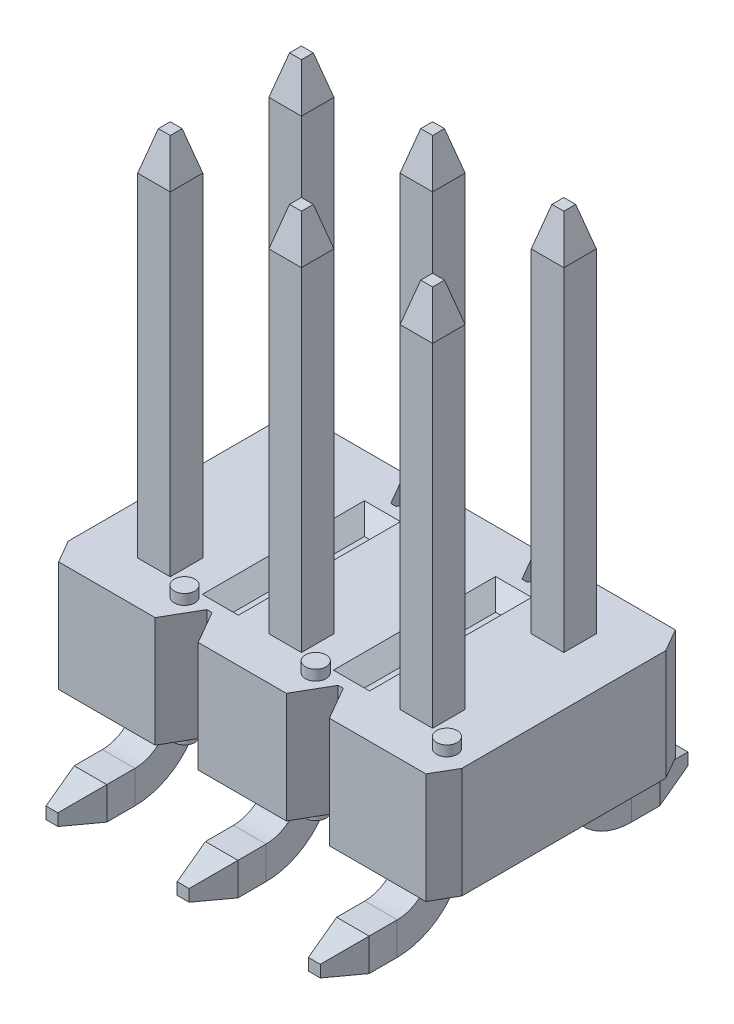
from build123d import *

# Parameters (mm, degrees)
BOSS_EXTRUDE1_DEPTH      = 2.14
BOSS_EXTRUDE2_START      = -2.34
SKETCH2_R                = 0.2
BOSS_EXTRUDE2_DEPTH      = 2.54
LPATTERN1_COUNT          = 3
LPATTERN1_PITCH          = 2.54
SKETCH3_W                = 0.1
SKETCH3_H                = 2.54
CUT_EXTRUDE1_DEPTH       = 0.3
CHAMFER1_SIZE            = 0.3
CHAMFER1_OF_MIRROR2_SIZE = 0.3
SKETCH6_W                = 0.63
SKETCH6_H                = 0.63
CHAMFER2_SIZE            = 0.2
CHAMFER2_SIZE2           = 0.746410162
CHAMFER3_SIZE            = 0.2
CHAMFER3_SIZE2           = 0.746410162
LPATTERN2_START          = -0.315
LPATTERN2_DEPTH          = 0.63
LPATTERN2_START_2        = 2.225
LPATTERN2_2_DEPTH        = 0.63
LPATTERN2_START_3        = -1
LPATTERN2_3_DEPTH        = 2.36
LPATTERN2_START_4        = -3
LPATTERN2_4_DEPTH        = 3
MIRROR4_START            = -2.855
MIRROR4_DEPTH            = 0.63
MIRROR4_START_2          = -0.315
MIRROR4_2_DEPTH          = 0.63
MIRROR4_START_3          = 2.225
MIRROR4_3_DEPTH          = 0.63
MIRROR4_4_DEPTH          = 2.813589838
MIRROR4_START_4          = -1
MIRROR4_5_DEPTH          = 2.36


with BuildPart() as part:
    # Sketch1 → Boss-Extrude1 (new body)
    with BuildSketch(Plane(origin=(0, 1.36, 0), x_dir=(1, 0, 0), z_dir=(0, 1, 0))):
        Polygon((-1.686617421, 2.415), (-1.32, 1.78), (-1.22, 1.78), (-0.853382579, 2.415), (0.853382579, 2.415), (1.22, 1.78), (1.32, 1.78), (1.686617421, 2.415), (3.556, 2.415), (3.81, 1.975059095), (3.81, -1.975059095), (3.556, -2.415), (1.686617421, -2.415), (1.32, -1.78), (1.22, -1.78), (0.853382579, -2.415), (-0.853382579, -2.415), (-1.22, -1.78), (-1.32, -1.78), (-1.686617421, -2.415), (-3.556, -2.415), (-3.81, -1.975059095), (-3.81, 1.975059095), (-3.556, 2.415), align=None)
    extrude(amount=BOSS_EXTRUDE1_DEPTH)

    # Sketch2 → Boss-Extrude2 (add)
    with BuildSketch(Plane(origin=(0, 3.5, 0), x_dir=(1, 0, 0), z_dir=(0, 1, 0)).offset(BOSS_EXTRUDE2_START)):
        with Locations(Location((-3.3325, 1.785, 0), (0, 0, 270))):
            Circle(SKETCH2_R)
        with Locations(Location((-1.7475, -1.785, 0), (0, 0, 270))):
            Circle(SKETCH2_R)
    boss_extrude2 = extrude(amount=BOSS_EXTRUDE2_DEPTH)

    # LPattern1: Boss-Extrude2 ×3
    with Locations(*[(i * LPATTERN1_PITCH, 0, 0) for i in range(1, LPATTERN1_COUNT)]):
        add(boss_extrude2)

    # Sketch3 → Cut-Extrude1 (cut)
    with BuildSketch(Plane(origin=(0, 3.5, 0), x_dir=(1, 0, 0), z_dir=(0, 1, 0))):
        with Locations((-1.27, 0)):
            Rectangle(SKETCH3_W, SKETCH3_H)
        with Locations((1.27, 0)):
            Rectangle(SKETCH3_W, SKETCH3_H)
    cut_extrude1 = extrude(amount=-CUT_EXTRUDE1_DEPTH, mode=Mode.SUBTRACT)

    # Chamfer1
    chamfer1_edges = [part.edges().sort_by_distance(p)[0] for p in [
        (-1.27, 3.5, 1.27),
        (-1.22, 3.5, 0),
        (-1.27, 3.5, -1.27),
        (-1.32, 3.5, 0),
        (1.27, 3.5, 1.27),
        (1.32, 3.5, 0),
        (1.22, 3.5, 0),
        (1.27, 3.5, -1.27),
    ]]
    chamfer(chamfer1_edges, length=CHAMFER1_SIZE - 0.0001)  # a hair under: the kernel refuses the full size

    # Mirror2: Cut-Extrude1 across plane
    add(cut_extrude1.mirror(Plane.ZX.offset(2.43)), mode=Mode.SUBTRACT)

    # Chamfer1 of Mirror2
    chamfer1_of_mirror2_edges = [part.edges().sort_by_distance(p)[0] for p in [
        (-1.27, 1.36, 1.27),
        (-1.22, 1.36, 0),
        (-1.27, 1.36, -1.27),
        (-1.32, 1.36, 0),
        (1.27, 1.36, 1.27),
        (1.32, 1.36, 0),
        (1.22, 1.36, 0),
        (1.27, 1.36, -1.27),
    ]]
    chamfer(chamfer1_of_mirror2_edges, length=CHAMFER1_OF_MIRROR2_SIZE - 0.0001)  # a hair under: the kernel refuses the full size

    # Sweep1: sweep along a path in Sketch5
    with BuildLine(Plane(origin=(-2.54, 0, 0), x_dir=(0, 0, -1), z_dir=(1, 0, 0))) as sweep1_path:
        Line((1.27, 10.7), (1.27, 1.315))
        ThreePointArc((1.27, 1.315), (1.562893219, 0.607893219), (2.27, 0.315))
        Line((2.27, 0.315), (3.56, 0.315))
    # Sketch6 → Sweep1 (sweep)
    with BuildSketch(Plane(origin=(0, 10.7, 0), x_dir=(1, 0, 0), z_dir=(0, 1, 0))):
        with Locations((-2.54, 1.27)):
            Rectangle(SKETCH6_W, SKETCH6_H)
    sweep(path=sweep1_path.line)

    # Chamfer2
    chamfer2_edges = [part.edges().sort_by_distance(p)[0] for p in [
        (-2.54, 0, -3.56),
        (-2.855, 0.315, -3.56),
        (-2.54, 0.63, -3.56),
        (-2.225, 0.315, -3.56),
    ]]
    chamfer2_side = [part.faces().sort_by_distance(p)[0] for p in [
        (-2.54, 0.315, -3.56),
    ]]
    chamfer(chamfer2_edges, length=CHAMFER2_SIZE, length2=CHAMFER2_SIZE2, reference=chamfer2_side[0])

    # Chamfer3
    chamfer3_edges = [part.edges().sort_by_distance(p)[0] for p in [
        (-2.225, 10.7, -1.27),
        (-2.54, 10.7, -1.585),
        (-2.855, 10.7, -1.27),
        (-2.54, 10.7, -0.955),
    ]]
    chamfer3_side = [part.faces().sort_by_distance(p)[0] for p in [
        (-2.54, 10.7, -1.27),
    ]]
    chamfer(chamfer3_edges, length=CHAMFER3_SIZE, length2=CHAMFER3_SIZE2, reference=chamfer3_side[0])

    # LPattern2: read off the stored shape, not the designer's step
    # LPattern2 outline → LPattern2 (add)
    with BuildSketch(Plane.YZ.offset(LPATTERN2_START)):
        Polygon((10.7, -1.385), (10.7, -1.155), (9.953589838, -0.955), (3.5, -0.955), (3.5, -1.585), (9.953589838, -1.585), align=None)
        with BuildLine():
            ThreePointArc((0.63, -2.27), (0.830631855, -1.785631855), (1.315, -1.585))
            Line((1.315, -1.585), (1.36, -1.585))
            Line((1.36, -1.585), (1.36, -0.955))
            Line((1.36, -0.955), (1.315, -0.955))
            ThreePointArc((1.315, -0.955), (0.385154583, -1.340154583), (0, -2.27))
            Line((0, -2.27), (0, -2.813589838))
            Line((0, -2.813589838), (0.2, -3.56))
            Line((0.2, -3.56), (0.43, -3.56))
            Line((0.43, -3.56), (0.63, -2.813589838))
            Line((0.63, -2.813589838), (0.63, -2.27))
        make_face()
    extrude(amount=LPATTERN2_DEPTH)

    # LPattern2 2 outline → LPattern2 2 (add)
    with BuildSketch(Plane.YZ.offset(LPATTERN2_START_2)):
        Polygon((10.7, -1.385), (10.7, -1.155), (9.953589838, -0.955), (3.5, -0.955), (3.5, -1.585), (9.953589838, -1.585), align=None)
        with BuildLine():
            ThreePointArc((0.63, -2.27), (0.830631855, -1.785631855), (1.315, -1.585))
            Line((1.315, -1.585), (1.36, -1.585))
            Line((1.36, -1.585), (1.36, -0.955))
            Line((1.36, -0.955), (1.315, -0.955))
            ThreePointArc((1.315, -0.955), (0.385154583, -1.340154583), (0, -2.27))
            Line((0, -2.27), (0, -2.813589838))
            Line((0, -2.813589838), (0.2, -3.56))
            Line((0.2, -3.56), (0.43, -3.56))
            Line((0.43, -3.56), (0.63, -2.813589838))
            Line((0.63, -2.813589838), (0.63, -2.27))
        make_face()
    extrude(amount=LPATTERN2_2_DEPTH)

    # LPattern2 3 outline → LPattern2 3 (cut)
    with BuildSketch(Plane(origin=(0, 0, 0), x_dir=(1, 0, 0), z_dir=(0, 1, 0)).offset(LPATTERN2_START_3)):
        Polygon((-0.315, 2.813589838), (-0.115, 3.56), (-0.315, 3.56), align=None)
        Polygon((0.115, 3.56), (0.315, 2.813589838), (0.315, 3.56), align=None)
        Polygon((2.225, 2.813589838), (2.425, 3.56), (2.225, 3.56), align=None)
        Polygon((2.655, 3.56), (2.855, 2.813589838), (2.855, 3.56), align=None)
    extrude(amount=LPATTERN2_3_DEPTH, mode=Mode.SUBTRACT)

    # LPattern2 4 outline → LPattern2 4 (cut)
    with BuildSketch(Plane.XY.offset(LPATTERN2_START_4)):
        Polygon((-0.315, 9.953589838), (-0.115, 10.7), (-0.315, 10.7), align=None)
        Polygon((0.315, 10.7), (0.115, 10.7), (0.315, 9.953589838), align=None)
        Polygon((2.225, 9.953589838), (2.425, 10.7), (2.225, 10.7), align=None)
        Polygon((2.855, 10.7), (2.655, 10.7), (2.855, 9.953589838), align=None)
    extrude(amount=LPATTERN2_4_DEPTH, mode=Mode.SUBTRACT)

    # Mirror4: read off the stored shape, not the designer's step
    # Mirror4 outline → Mirror4 (add)
    with BuildSketch(Plane.YZ.offset(MIRROR4_START)):
        Polygon((10.7, 1.155), (10.7, 1.385), (9.953589838, 1.585), (3.5, 1.585), (3.5, 0.955), (9.953589838, 0.955), align=None)
        with BuildLine():
            Line((0, 2.813589838), (0, 2.27))
            ThreePointArc((0, 2.27), (0.385154583, 1.340154583), (1.315, 0.955))
            Line((1.315, 0.955), (1.36, 0.955))
            Line((1.36, 0.955), (1.36, 1.585))
            Line((1.36, 1.585), (1.315, 1.585))
            ThreePointArc((1.315, 1.585), (0.830631855, 1.785631855), (0.63, 2.27))
            Line((0.63, 2.27), (0.63, 2.813589838))
            Line((0.63, 2.813589838), (0.43, 3.56))
            Line((0.43, 3.56), (0.2, 3.56))
            Line((0.2, 3.56), (0, 2.813589838))
        make_face()
    extrude(amount=MIRROR4_DEPTH)

    # Mirror4 2 outline → Mirror4 2 (add)
    with BuildSketch(Plane.YZ.offset(MIRROR4_START_2)):
        Polygon((10.7, 1.155), (10.7, 1.385), (9.953589838, 1.585), (3.5, 1.585), (3.5, 0.955), (9.953589838, 0.955), align=None)
        with BuildLine():
            Line((0, 2.813589838), (0, 2.27))
            ThreePointArc((0, 2.27), (0.385154583, 1.340154583), (1.315, 0.955))
            Line((1.315, 0.955), (1.36, 0.955))
            Line((1.36, 0.955), (1.36, 1.585))
            Line((1.36, 1.585), (1.315, 1.585))
            ThreePointArc((1.315, 1.585), (0.830631855, 1.785631855), (0.63, 2.27))
            Line((0.63, 2.27), (0.63, 2.813589838))
            Line((0.63, 2.813589838), (0.43, 3.56))
            Line((0.43, 3.56), (0.2, 3.56))
            Line((0.2, 3.56), (0, 2.813589838))
        make_face()
    extrude(amount=MIRROR4_2_DEPTH)

    # Mirror4 3 outline → Mirror4 3 (add)
    with BuildSketch(Plane.YZ.offset(MIRROR4_START_3)):
        Polygon((10.7, 1.155), (10.7, 1.385), (9.953589838, 1.585), (3.5, 1.585), (3.5, 0.955), (9.953589838, 0.955), align=None)
        with BuildLine():
            Line((0, 2.813589838), (0, 2.27))
            ThreePointArc((0, 2.27), (0.385154583, 1.340154583), (1.315, 0.955))
            Line((1.315, 0.955), (1.36, 0.955))
            Line((1.36, 0.955), (1.36, 1.585))
            Line((1.36, 1.585), (1.315, 1.585))
            ThreePointArc((1.315, 1.585), (0.830631855, 1.785631855), (0.63, 2.27))
            Line((0.63, 2.27), (0.63, 2.813589838))
            Line((0.63, 2.813589838), (0.43, 3.56))
            Line((0.43, 3.56), (0.2, 3.56))
            Line((0.2, 3.56), (0, 2.813589838))
        make_face()
    extrude(amount=MIRROR4_3_DEPTH)

    # Mirror4 4 outline → Mirror4 4 (cut)
    with BuildSketch(Plane.XY):
        Polygon((-2.855, 9.953589838), (-2.655, 10.7), (-2.855, 10.7), align=None)
        Polygon((-2.225, 10.7), (-2.425, 10.7), (-2.225, 9.953589838), align=None)
        Polygon((-0.315, 9.953589838), (-0.115, 10.7), (-0.315, 10.7), align=None)
        Polygon((0.315, 10.7), (0.115, 10.7), (0.315, 9.953589838), align=None)
        Polygon((2.225, 9.953589838), (2.425, 10.7), (2.225, 10.7), align=None)
        Polygon((2.855, 10.7), (2.655, 10.7), (2.855, 9.953589838), align=None)
    extrude(amount=MIRROR4_4_DEPTH, mode=Mode.SUBTRACT)

    # Mirror4 5 outline → Mirror4 5 (cut)
    with BuildSketch(Plane(origin=(0, 0, 0), x_dir=(1, 0, 0), z_dir=(0, 1, 0)).offset(MIRROR4_START_4)):
        Polygon((-2.225, -2.813589838), (-2.425, -3.56), (-2.225, -3.56), align=None)
        Polygon((-2.855, -3.56), (-2.655, -3.56), (-2.855, -2.813589838), align=None)
        Polygon((0.315, -2.813589838), (0.115, -3.56), (0.315, -3.56), align=None)
        Polygon((-0.315, -3.56), (-0.115, -3.56), (-0.315, -2.813589838), align=None)
        Polygon((2.855, -2.813589838), (2.655, -3.56), (2.855, -3.56), align=None)
        Polygon((2.225, -3.56), (2.425, -3.56), (2.225, -2.813589838), align=None)
    extrude(amount=MIRROR4_5_DEPTH, mode=Mode.SUBTRACT)


solid = part.part
